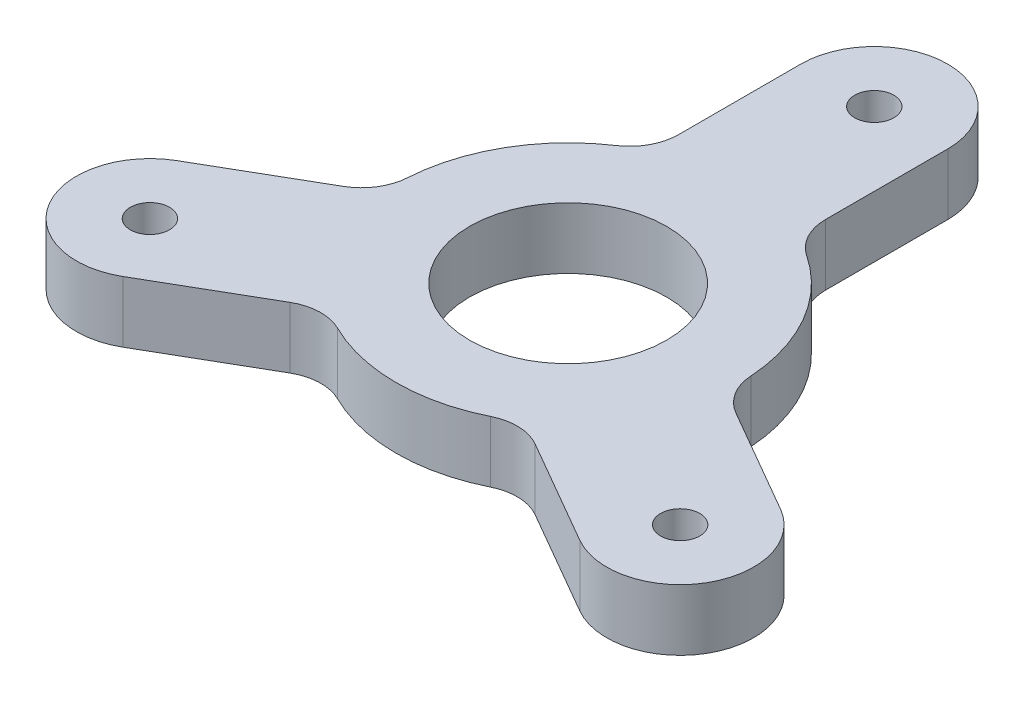
from build123d import *

# Parameters (mm, degrees)
SKETCH1_R           = 8.05
SKETCH1_R_2         = 1.6
BOSS_EXTRUDE1_DEPTH = 5


with BuildPart() as part:
    # Sketch1 → Boss-Extrude1 (new body)
    with BuildSketch(Plane(origin=(0, 0, 0), x_dir=(1, 0, 0), z_dir=(0, 1, 0))):
        with BuildLine():
            Line((24.650635095, -7.303847577), (16.013526617, -2.317210672))
            ThreePointArc((16.013526617, -2.317210672), (14.614747196, -0.962208024), (14.021609361, 0.892732285))
            ThreePointArc((14.021609361, 0.892732285), (12.167656923, 7.025), (7.783933518, 11.696703766))
            ThreePointArc((7.783933518, 11.696703766), (6.474077005, 13.137846354), (6, 15.02672619))
            Line((6, 15.02672619), (6, 25))
            ThreePointArc((6, 25), (0, 31), (-6, 25))
            Line((-6, 25), (-6, 15.02672619))
            ThreePointArc((-6, 15.02672619), (-6.474077005, 13.137846354), (-7.783933518, 11.696703766))
            ThreePointArc((-7.783933518, 11.696703766), (-12.167656923, 7.025), (-14.021609361, 0.892732285))
            ThreePointArc((-14.021609361, 0.892732285), (-14.614747196, -0.962208024), (-16.013526617, -2.317210672))
            Line((-16.013526617, -2.317210672), (-24.650635095, -7.303847577))
            ThreePointArc((-24.650635095, -7.303847577), (-26.846787517, -15.5), (-18.650635095, -17.696152423))
            Line((-18.650635095, -17.696152423), (-10.013526617, -12.709515518))
            ThreePointArc((-10.013526617, -12.709515518), (-8.140670191, -12.17563833), (-6.237675843, -12.589436051))
            ThreePointArc((-6.237675843, -12.589436051), (0, -14.05), (6.237675843, -12.589436051))
            ThreePointArc((6.237675843, -12.589436051), (8.140670191, -12.17563833), (10.013526617, -12.709515518))
            Line((10.013526617, -12.709515518), (18.650635095, -17.696152423))
            ThreePointArc((18.650635095, -17.696152423), (26.846787517, -15.5), (24.650635095, -7.303847577))
        make_face()
        Circle(SKETCH1_R, mode=Mode.SUBTRACT)
        with Locations((0, 25)):
            Circle(SKETCH1_R_2, mode=Mode.SUBTRACT)
        with Locations((21.650635095, -12.5)):
            Circle(SKETCH1_R_2, mode=Mode.SUBTRACT)
        with Locations((-21.650635095, -12.5)):
            Circle(SKETCH1_R_2, mode=Mode.SUBTRACT)
    extrude(amount=BOSS_EXTRUDE1_DEPTH)


solid = part.part
